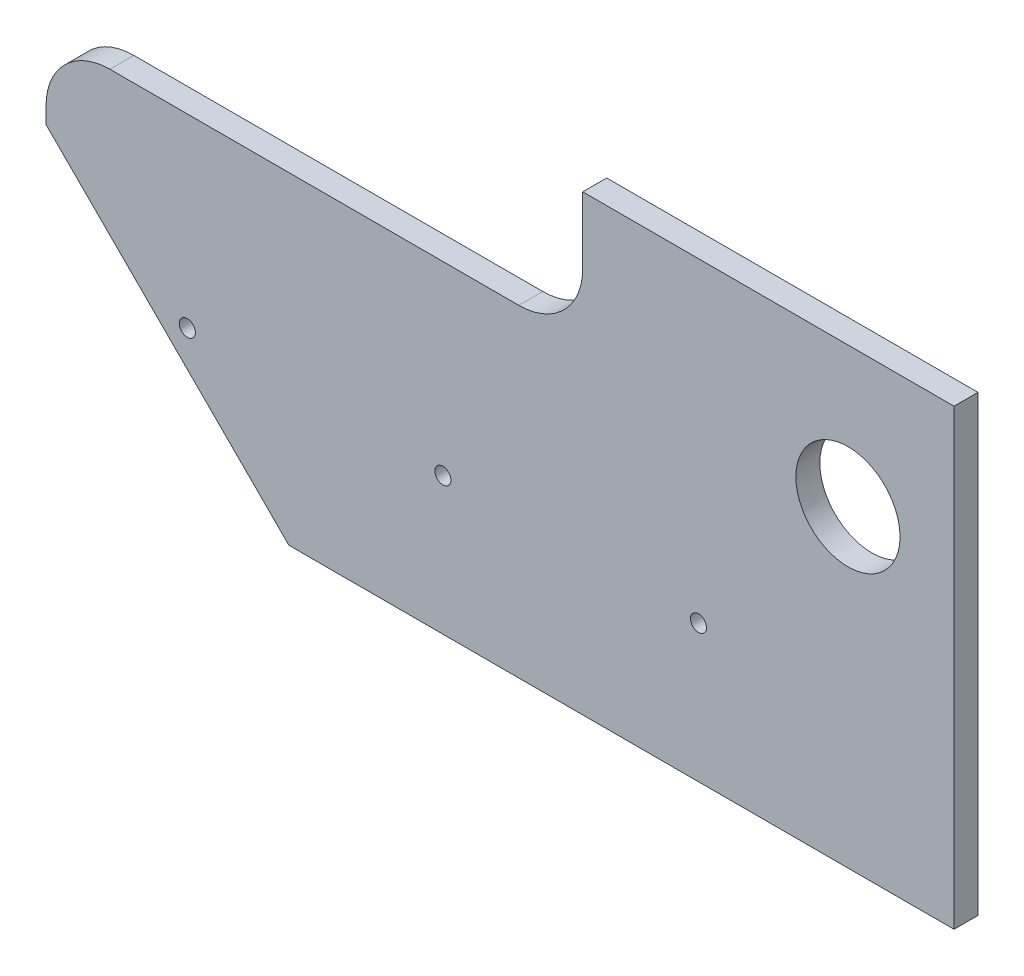
from build123d import *

# Parameters (mm, degrees)
SKETCH1_R                  = 20.701
BOSS_EXTRUDE1_DEPTH        = 9.525
SKETCH2_W                  = 285.57287806
SKETCH2_H                  = 73.914
CUT_EXTRUDE1_DEPTH         = 267.58430025
SKETCH4_W                  = 213.36
SKETCH4_H                  = 65.465352004
CUT_EXTRUDE2_DEPTH         = 267.58430025
FILLET2_R                  = 25.4
F_6_4_6_4_DIAMETER_HOLE2_D = 6.4
SKETCH16_W                 = 9.525
SKETCH16_H                 = 0.985363282
CUT_EXTRUDE3_DEPTH         = 390.572219806
SKETCH17_W                 = 147.610011278
SKETCH17_H                 = 12.7
CUT_EXTRUDE4_DEPTH         = 267.045158533


with BuildPart() as part:
    # Sketch1 → Boss-Extrude1 (new body)
    with BuildSketch(Plane.XY):
        Polygon((-138.259383474, 48.991487021), (32.210627804, -121.478524257), (222.710627804, -121.478524257), (222.710627804, 146.206839025), (-138.259383474, 146.206839025), align=None)
        with Locations((180.538014078, 76.831975743)):
            Circle(SKETCH1_R, mode=Mode.SUBTRACT)
    extrude(amount=BOSS_EXTRUDE1_DEPTH)

    # Sketch2 → Cut-Extrude1 (cut, through all)
    with BuildSketch(Plane.XY.offset(9.525)):
        with Locations((98.974188774, -84.521524257)):
            Rectangle(SKETCH2_W, SKETCH2_H)
    extrude(amount=-CUT_EXTRUDE1_DEPTH, mode=Mode.SUBTRACT)

    # Sketch4 → Cut-Extrude2 (cut, through all)
    with BuildSketch(Plane.XY.offset(9.525)):
        with Locations((-31.579383474, 113.474163023)):
            Rectangle(SKETCH4_W, SKETCH4_H)
    extrude(amount=-CUT_EXTRUDE2_DEPTH, mode=Mode.SUBTRACT)

    # Fillet2
    fillet2_edges = [part.edges().sort_by_distance(p)[0] for p in [
        (-138.259383474, 80.741487021, 4.7625),
        (75.100616526, 80.741487021, 4.7625),
    ]]
    fillet(fillet2_edges, radius=FILLET2_R)

    # Ø6.4 (6.4) Diameter Hole2 (through all)
    with Locations(Plane(origin=(0, 0, 0), x_dir=(-1, 0, 0), z_dir=(0, 0, -1))):
        with Locations((-121.110627804, 7.042935743), (-19.510627804, 7.042935743), (82.089372196, 7.042935743)):
            Hole(F_6_4_6_4_DIAMETER_HOLE2_D / 2)

    # Sketch16 → Cut-Extrude3 (cut, through all)
    with BuildSketch(Plane(origin=(222.710627804, 0, 0), x_dir=(0, 0, -1), z_dir=(1, 0, 0))):
        with Locations((-4.7625, 145.714157384)):
            Rectangle(SKETCH16_W, SKETCH16_H)
    extrude(amount=-CUT_EXTRUDE3_DEPTH, mode=Mode.SUBTRACT)

    # Sketch17 → Cut-Extrude4 (cut, through all)
    with BuildSketch(Plane(origin=(0, 0, 0), x_dir=(-1, 0, 0), z_dir=(0, 0, -1))):
        with Locations((-148.905622165, 138.871475743)):
            Rectangle(SKETCH17_W, SKETCH17_H)
    extrude(amount=-CUT_EXTRUDE4_DEPTH, mode=Mode.SUBTRACT)


solid = part.part
